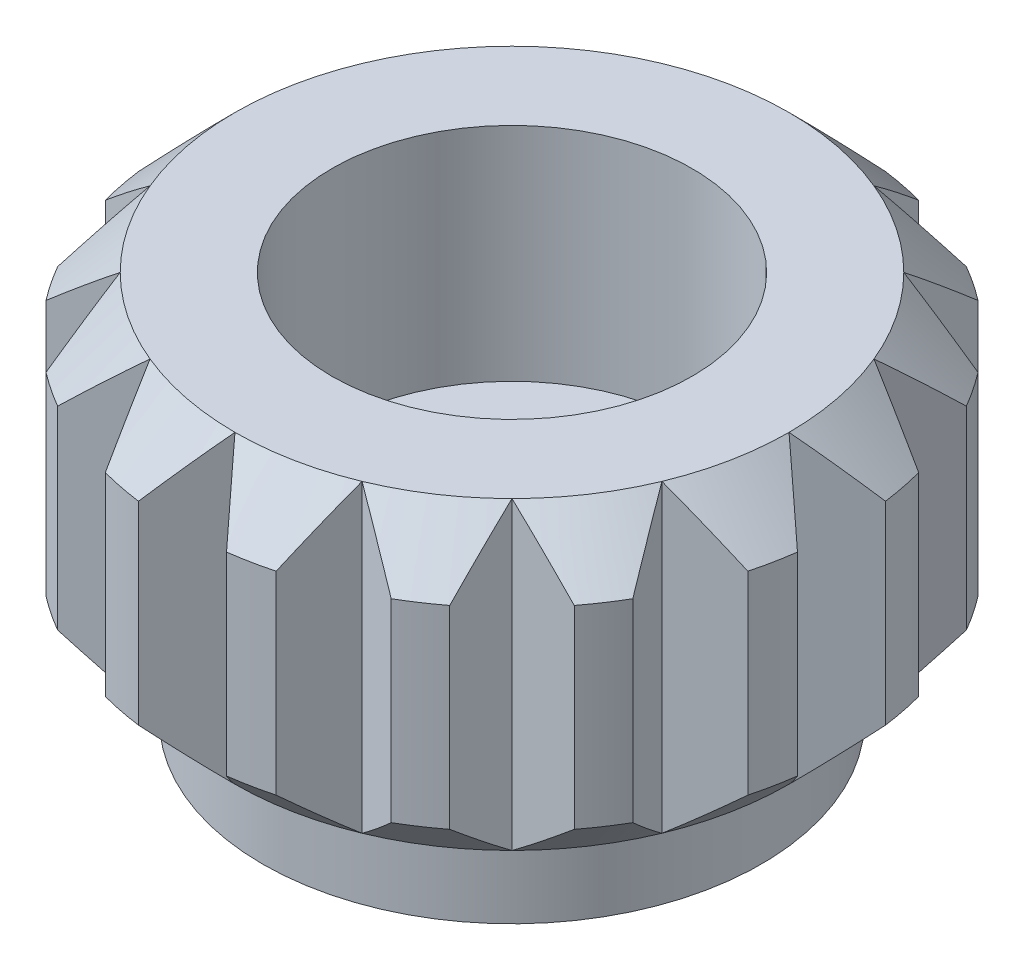
from build123d import *

# Parameters (mm, degrees)
ESQUISSE1_R                                     = 6
BOSS_EXTRU_1_DEPTH                              = 7
ESQUISSE2_OUTSIDE_W                             = 17.672
ESQUISSE2_OUTSIDE_H                             = 17.672
ESQUISSE2_OUTSIDE_R                             = 4.5
ENL_V_MAT_EXTRU_1_DEPTH                         = 1.5
CHANFREIN1_SIZE                                 = 1
CHAMBRAGE_POUR_VIS_T_TE_CYLINDRIQUE_D           = 3.2
CHAMBRAGE_POUR_VIS_T_TE_CYLINDRIQUE_CBORE_D     = 6.5
CHAMBRAGE_POUR_VIS_T_TE_CYLINDRIQUE_CBORE_DEPTH = 4
ENL_V_MAT_EXTRU_2_DEPTH                         = 12
R_P_TITION_CIRCULAIRE1_COUNT                    = 16


with BuildPart() as part:
    # Esquisse1 → Boss.-Extru.1 (new body)
    with BuildSketch(Plane(origin=(0, 0, 0), x_dir=(1, 0, 0), z_dir=(0, 1, 0))):
        Circle(ESQUISSE1_R)
    extrude(amount=BOSS_EXTRU_1_DEPTH)

    # Esquisse2 outside → Enlèv. mat.-Extru.1 (cut)
    with BuildSketch(Plane.XZ):
        Rectangle(ESQUISSE2_OUTSIDE_W, ESQUISSE2_OUTSIDE_H)
        Circle(ESQUISSE2_OUTSIDE_R, mode=Mode.SUBTRACT)
    extrude(amount=-ENL_V_MAT_EXTRU_1_DEPTH, mode=Mode.SUBTRACT)

    # Chanfrein1
    chanfrein1_edges = [part.edges().sort_by_distance(p)[0] for p in [
        (-6, 7, 0),
        (-6, 1.5, 0),
    ]]
    chamfer(chanfrein1_edges, length=CHANFREIN1_SIZE)

    # Chambrage pour vis à tête cylindrique à 6 pans creux (ou vis CHC) M31 (through all)
    with Locations(Plane(origin=(0, 7, 0), x_dir=(1, 0, 0), z_dir=(0, 1, 0))):
        with Locations((0, 0)):
            CounterBoreHole(CHAMBRAGE_POUR_VIS_T_TE_CYLINDRIQUE_D / 2, CHAMBRAGE_POUR_VIS_T_TE_CYLINDRIQUE_CBORE_D / 2, CHAMBRAGE_POUR_VIS_T_TE_CYLINDRIQUE_CBORE_DEPTH)

    # Esquisse5 → Enlèv. mat.-Extru.2 (cut, through all)
    with BuildSketch(Plane(origin=(0, 7, 0), x_dir=(1, 0, 0), z_dir=(0, 1, 0))):
        Polygon((-5, 0), (-6.645642825, 1.380858287), (-6.645642825, -1.380858287), align=None)
    enl_v_mat_extru_2 = extrude(amount=-ENL_V_MAT_EXTRU_2_DEPTH, mode=Mode.SUBTRACT)

    # Répétition circulaire1: Enlèv. mat.-Extru.2 ×16 about axis
    r_p_tition_circulaire1_axis = Axis((0, 7, 0), (0, 1, 0))
    for i in range(1, R_P_TITION_CIRCULAIRE1_COUNT):
        add(enl_v_mat_extru_2.rotate(r_p_tition_circulaire1_axis, i * 360 / R_P_TITION_CIRCULAIRE1_COUNT), mode=Mode.SUBTRACT)


solid = part.part
